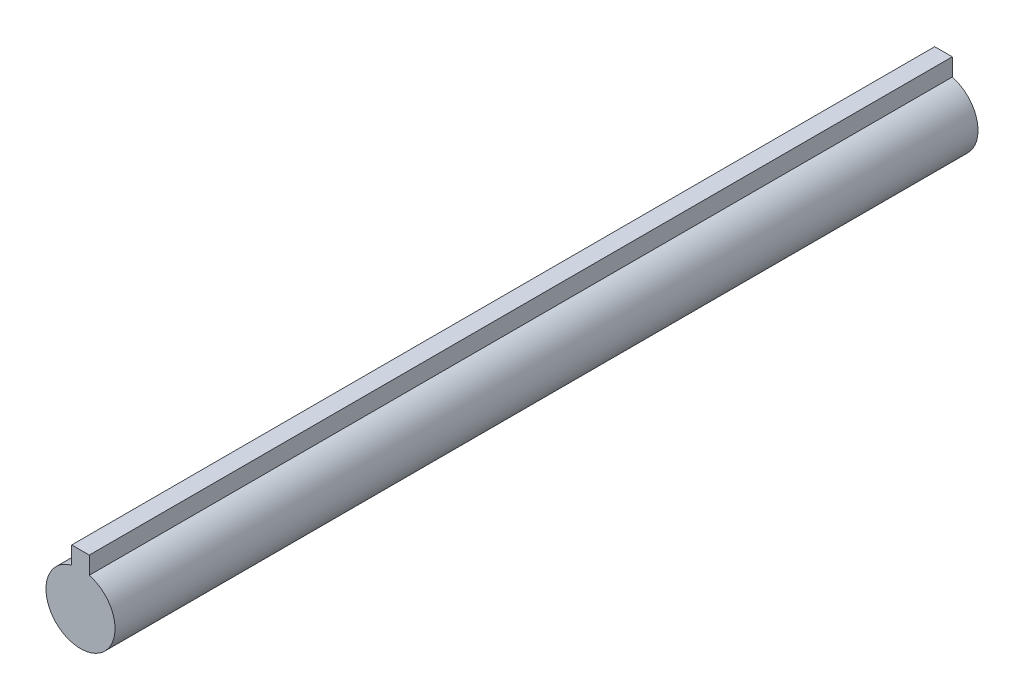
from build123d import *

# Parameters (mm, degrees)
BOSS_EXTRUDE1_DEPTH = 12.5


with BuildPart() as part:
    # Sketch1 → Boss-Extrude1 (new, symmetric)
    with BuildSketch(Plane.XY):
        with BuildLine():
            Line((-0.254, 1.475204218), (-0.254, 0.967204218))
            ThreePointArc((-0.254, 0.967204218), (0, -1), (0.254, 0.967204218))
            Line((0.254, 0.967204218), (0.254, 1.475204218))
            Line((0.254, 1.475204218), (-0.254, 1.475204218))
        make_face()
    extrude(amount=BOSS_EXTRUDE1_DEPTH, both=True)


solid = part.part
